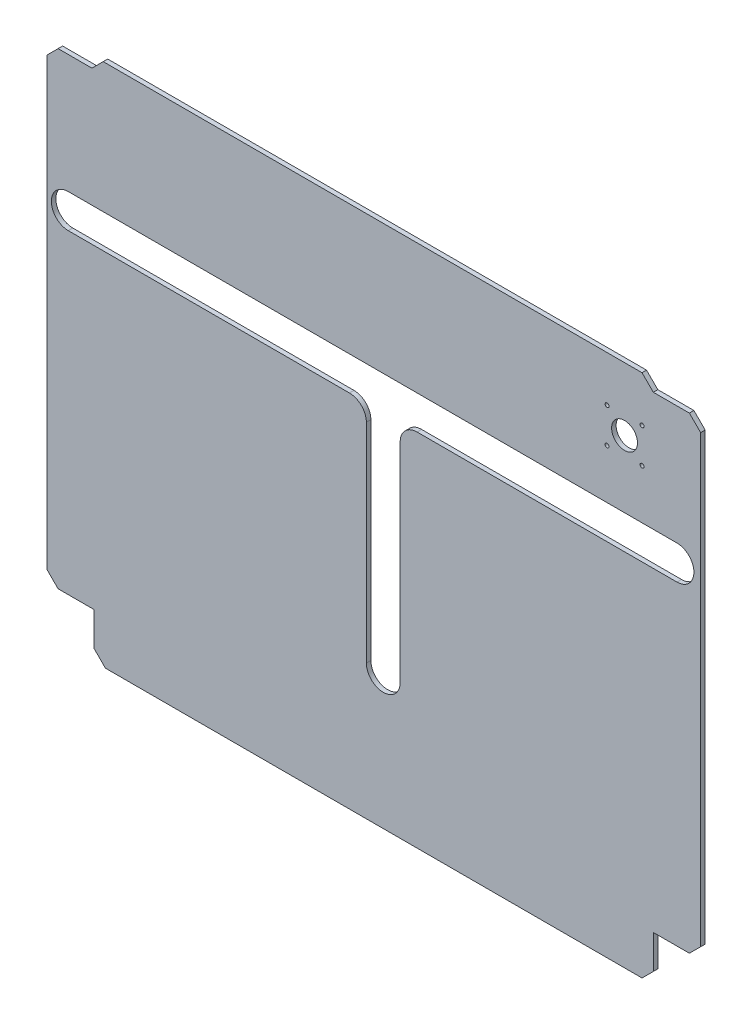
from build123d import *

# Parameters (mm, degrees)
SKETCH1_R           = 1.75
SKETCH1_R_2         = 11.5
BOSS_EXTRUDE1_DEPTH = 4
CHAMFER1_SIZE       = 10
CHAMFER2_SIZE       = 10
CUT_EXTRUDE1_DEPTH  = 10
CUT_EXTRUDE2_DEPTH  = 10
FILLET1_R           = 15


with BuildPart() as part:
    # Sketch1 → Boss-Extrude1 (new body)
    with BuildSketch(Plane.XY):
        Polygon((-39.680258263, -5.004819249), (0.319741737, -5.004819249), (0.319741737, 4.995180751), (498.319741737, 4.995180751), (498.319741737, -5.004819249), (540.319741737, -5.004819249), (540.319741737, -420.004819249), (498.319741737, -420.004819249), (498.319741737, -460.004819249), (2.319741737, -460.004819249), (2.319741737, -420.004819249), (-39.680258263, -420.004819249), align=None)
        with Locations((457.319741737, -35.448212978)):
            Circle(SKETCH1_R, mode=Mode.SUBTRACT)
        with Locations((457.319741737, -66.448212978)):
            Circle(SKETCH1_R, mode=Mode.SUBTRACT)
        with Locations((488.319741737, -66.448212978)):
            Circle(SKETCH1_R, mode=Mode.SUBTRACT)
        with Locations((488.319741737, -35.448212978)):
            Circle(SKETCH1_R, mode=Mode.SUBTRACT)
        with Locations((472.819741737, -50.948212978)):
            Circle(SKETCH1_R_2, mode=Mode.SUBTRACT)
    extrude(amount=BOSS_EXTRUDE1_DEPTH)

    # Chamfer1
    chamfer1_edges = [part.edges().sort_by_distance(p)[0] for p in [
        (498.319741737, 4.995180751, 2),
        (0.319741737, 4.995180751, 2),
    ]]
    chamfer(chamfer1_edges, length=CHAMFER1_SIZE - 0.0001)  # a hair under: the kernel refuses the full size

    # Chamfer2
    chamfer2_edges = [part.edges().sort_by_distance(p)[0] for p in [
        (540.319741737, -5.004819249, 2),
        (540.319741737, -420.004819249, 2),
        (498.319741737, -460.004819249, 2),
        (2.319741737, -460.004819249, 2),
        (-39.680258263, -420.004819249, 2),
        (-39.680258263, -5.004819249, 2),
    ]]
    chamfer(chamfer2_edges, length=CHAMFER2_SIZE)

    # Sketch2 → Cut-Extrude1 (cut)
    with BuildSketch(Plane.XY.offset(4)):
        with BuildLine():
            Line((-20.680258263, -110.333406017), (519.319741737, -110.333406017))
            ThreePointArc((519.319741737, -110.333406017), (534.319741737, -125.333406017), (519.319741737, -140.333406017))
            Line((519.319741737, -140.333406017), (-20.680258263, -140.333406017))
            ThreePointArc((-20.680258263, -140.333406017), (-35.680258263, -125.333406017), (-20.680258263, -110.333406017))
        make_face()
    extrude(amount=-CUT_EXTRUDE1_DEPTH, mode=Mode.SUBTRACT)

    # Sketch3 → Cut-Extrude2 (cut)
    with BuildSketch(Plane(origin=(0, 0, 0), x_dir=(-1, 0, 0), z_dir=(0, 0, -1))):
        with BuildLine():
            Line((-273.763542149, -140.333406017), (-273.763542149, -340.333406017))
            ThreePointArc((-273.763542149, -340.333406017), (-258.763542149, -355.333406017), (-243.763542149, -340.333406017))
            Line((-243.763542149, -340.333406017), (-243.763542149, -140.333406017))
            Line((-243.763542149, -140.333406017), (-273.763542149, -140.333406017))
        make_face()
    extrude(amount=-CUT_EXTRUDE2_DEPTH, mode=Mode.SUBTRACT)

    # Fillet1
    fillet1_edges = [part.edges().sort_by_distance(p)[0] for p in [
        (273.763542149, -140.333406017, 2),
        (243.763542149, -140.333406017, 2),
    ]]
    fillet(fillet1_edges, radius=FILLET1_R)


solid = part.part
